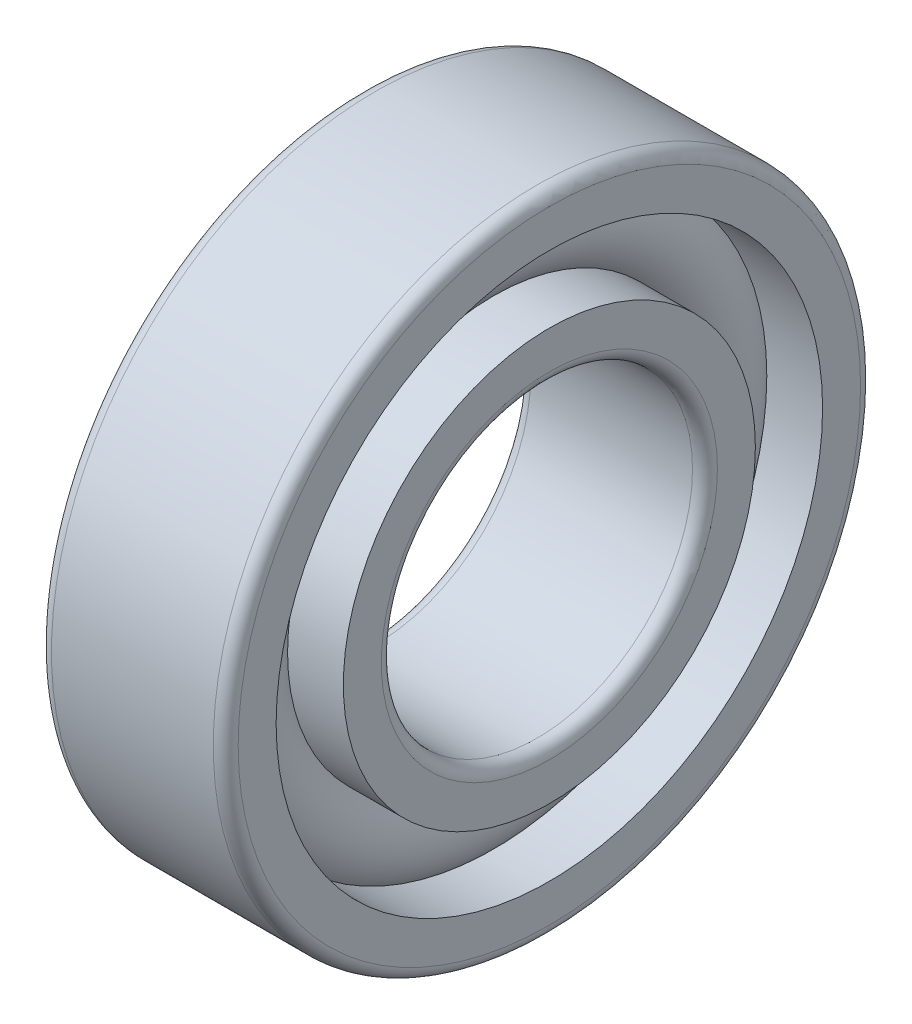
from build123d import *

# Parameters (mm, degrees)
CAGSPISKE_W     = 0.81
CAGSPISKE_H     = 1.35
CAGESPINE_ANGLE = 0.001
BALSIMSKE_R     = 4.05


with BuildPart() as part:
    # CagSpiSke → CageSpine (revolve)
    with BuildSketch(Plane.XY):
        with Locations((0, 19.25)):
            Rectangle(CAGSPISKE_W, CAGSPISKE_H)
    revolve(axis=Axis((-20.6375, 0, 0), (-1, 0, 0)), revolution_arc=CAGESPINE_ANGLE)

    # BalSimSke → BallsSimplified (revolve)
    with BuildSketch(Plane.XY):
        with Locations((0, 19.25)):
            Circle(BALSIMSKE_R)
    revolve(axis=Axis((-10, 0, 0), (1, 0, 0)))

    # InnRacSke → InnerRace (revolve)
    with BuildSketch(Plane.XY):
        with BuildLine():
            Line((-2.985067001, 16.55), (-7.5, 16.55))
            Line((-7.5, 16.55), (-7.5, 13.5))
            ThreePointArc((-7.5, 13.5), (-7.207106781, 12.792893219), (-6.5, 12.5))
            Line((-6.5, 12.5), (6.5, 12.5))
            ThreePointArc((6.5, 12.5), (7.207106781, 12.792893219), (7.5, 13.5))
            Line((7.5, 13.5), (7.5, 16.55))
            Line((7.5, 16.55), (2.985067001, 16.55))
            ThreePointArc((2.985067001, 16.55), (0, 15.225), (-2.985067001, 16.55))
        make_face()
    revolve(axis=Axis((-20.6375, 0, 0), (1, 0, 0)))

    # OutRacSke → OuterRace (revolve)
    with BuildSketch(Plane.XY):
        with BuildLine():
            Line((-2.985067001, 21.95), (-7.5, 21.95))
            Line((-7.5, 21.95), (-7.5, 25))
            ThreePointArc((-7.5, 25), (-7.207106781, 25.707106781), (-6.5, 26))
            Line((-6.5, 26), (6.5, 26))
            ThreePointArc((6.5, 26), (7.207106781, 25.707106781), (7.5, 25))
            Line((7.5, 25), (7.5, 21.95))
            Line((7.5, 21.95), (2.985067001, 21.95))
            ThreePointArc((2.985067001, 21.95), (0, 23.275), (-2.985067001, 21.95))
        make_face()
    revolve(axis=Axis((-20.6375, 0, 0), (1, 0, 0)))


solid = part.part
